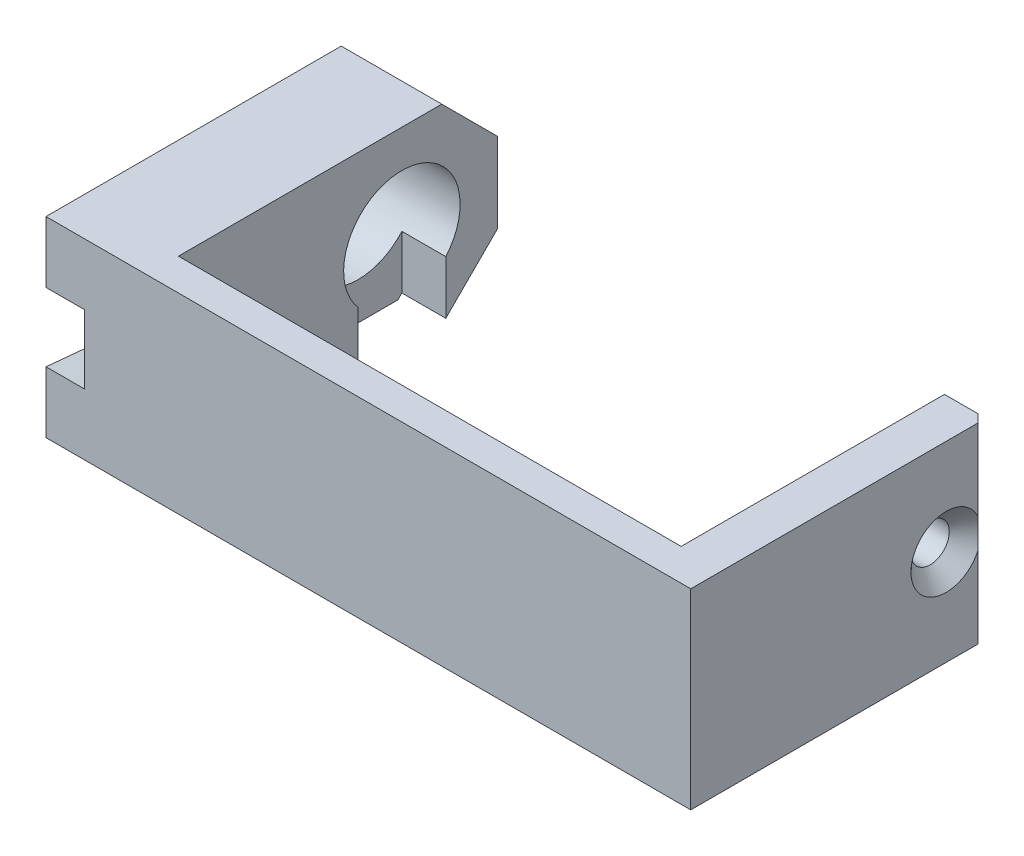
from build123d import *

# Parameters (mm, degrees)
SKETCH1_W                                       = 40.4
SKETCH1_H                                       = 12
BOSS_EXTRUDE1_DEPTH                             = 22
CUT_EXTRUDE1_REACH                              = 34.188
SKETCH2_W                                       = 31.5
SKETCH2_H                                       = 20
CUT_EXTRUDE2_REACH                              = 48.391
SKETCH4_R                                       = 0.9
CHAMFER1_SIZE                                   = 3.5
CSK_FOR_M2_FLAT_HEAD_MACHINE_SCREW1_D           = 2.4
CSK_FOR_M2_FLAT_HEAD_MACHINE_SCREW1_DEPTH       = 12.7
CSK_FOR_M2_FLAT_HEAD_MACHINE_SCREW1_CSINK_D     = 4.4
CSK_FOR_M2_FLAT_HEAD_MACHINE_SCREW1_CSINK_ANGLE = 90
CSK_FOR_M2_FLAT_HEAD_MACHINE_SCREW1_TIP         = 0.721032743
CHAMFER2_SIZE                                   = 4
BOSS_EXTRUDE2_START                             = 0.5
SKETCH20_R                                      = 2.5
SKETCH20_R_2                                    = 1.2
BOSS_EXTRUDE2_DEPTH                             = 0.5
CUT_EXTRUDE3_DEPTH                              = 2.4
SKETCH23_R                                      = 3.65
CUT_EXTRUDE4_DEPTH                              = 22.4
SKETCH24_W                                      = 5.5
SKETCH24_H                                      = 5.5
CUT_EXTRUDE5_DEPTH                              = 22.4


with BuildPart() as part:
    # Sketch1 → Boss-Extrude1 (new body)
    with BuildSketch(Plane.XY):
        Rectangle(SKETCH1_W, SKETCH1_H)
    extrude(amount=BOSS_EXTRUDE1_DEPTH)

    # Sketch2 → Cut-Extrude1 (cut, up to next)
    with BuildSketch(Plane(origin=(0, 6, 0), x_dir=(1, 0, 0), z_dir=(0, 1, 0)), mode=Mode.PRIVATE) as cut_extrude1_sk1:
        with Locations((1.85, -10)):
            Rectangle(SKETCH2_W, SKETCH2_H)
    cut_extrude1_tool1 = extrude(cut_extrude1_sk1.sketch, amount=-CUT_EXTRUDE1_REACH, mode=Mode.PRIVATE) & part.part
    add(cut_extrude1_tool1.solids().sort_by_distance((1.85, 6, 10))[0], mode=Mode.SUBTRACT)

    # Sketch4 → Cut-Extrude2 (cut, up to next)
    with BuildSketch(Plane(origin=(20.2, 0, 0), x_dir=(0, 0, -1), z_dir=(1, 0, 0)), mode=Mode.PRIVATE) as cut_extrude2_sk1:
        with Locations((-6, 0)):
            Circle(SKETCH4_R)
    cut_extrude2_tool1 = extrude(cut_extrude2_sk1.sketch, amount=-CUT_EXTRUDE2_REACH, mode=Mode.PRIVATE) & part.part
    add(cut_extrude2_tool1.solids().sort_by_distance((20.2, 0, 6))[0], mode=Mode.SUBTRACT)

    # Chamfer1
    chamfer1_edges = [part.edges().sort_by_distance(p)[0] for p in [
        (-17.05, -6, 0),
        (-17.05, 6, 0),
        (18.9, -6, 0),
        (18.9, 6, 0),
    ]]
    chamfer(chamfer1_edges, length=CHAMFER1_SIZE)

    # CSK for M2 Flat Head Machine Screw1
    with Locations(Plane(origin=(20.2, 0, 0), x_dir=(0, 0, -1), z_dir=(1, 0, 0))):
        with Locations((-6, 0)):
            CounterSinkHole(CSK_FOR_M2_FLAT_HEAD_MACHINE_SCREW1_D / 2, CSK_FOR_M2_FLAT_HEAD_MACHINE_SCREW1_CSINK_D / 2, depth=CSK_FOR_M2_FLAT_HEAD_MACHINE_SCREW1_DEPTH, counter_sink_angle=CSK_FOR_M2_FLAT_HEAD_MACHINE_SCREW1_CSINK_ANGLE)
            with Locations((0, 0, -(CSK_FOR_M2_FLAT_HEAD_MACHINE_SCREW1_DEPTH + CSK_FOR_M2_FLAT_HEAD_MACHINE_SCREW1_TIP / 2))):  # 118° drill point
                Cone(0, CSK_FOR_M2_FLAT_HEAD_MACHINE_SCREW1_D / 2, CSK_FOR_M2_FLAT_HEAD_MACHINE_SCREW1_TIP, mode=Mode.SUBTRACT)

    # Chamfer2
    # the kernel refuses this chamfer: 4 mm, written as the material it takes off along each edge
    with BuildSketch(Plane(origin=(20.2, 12.786731952, 0), x_dir=(-0.9996219169112968, 0, -0.027495876610586365), z_dir=(0, -1, 0))) as chamfer2_piece_1:
        Polygon((CHAMFER2_SIZE * 0.999621916911, -CHAMFER2_SIZE * 0.0274958766106), (-CHAMFER2_SIZE * 0.0274958766106, -CHAMFER2_SIZE * 0.999621916911), (0, 0), align=None)
    extrude(amount=25.573463904, mode=Mode.SUBTRACT)

    # Sketch20 → Boss-Extrude2 (add)
    with BuildSketch(Plane.ZY.offset(-17.6).offset(BOSS_EXTRUDE2_START)):
        with Locations(Location((6, 0, 0), (0, 0, 180))):
            Circle(SKETCH20_R)
        with Locations(Location((6, 0, 0), (0, 0, 180))):
            Circle(SKETCH20_R_2, mode=Mode.SUBTRACT)
    extrude(amount=-BOSS_EXTRUDE2_DEPTH)

    # Sketch5 → Cut-Extrude3 (cut)
    with BuildSketch(Plane.ZY.offset(20.2)):
        with BuildLine():
            Line((6.343920973, 3.633760912), (22.64787234, 2.090656963))
            ThreePointArc((22.64787234, 2.090656963), (24.55, 0), (22.64787234, -2.090656963))
            Line((22.64787234, -2.090656963), (6.343920973, -3.633760912))
            ThreePointArc((6.343920973, -3.633760912), (2.35, 0), (6.343920973, 3.633760912))
        make_face()
    extrude(amount=-CUT_EXTRUDE3_DEPTH, mode=Mode.SUBTRACT)

    # Sketch23 → Cut-Extrude4 (cut)
    with BuildSketch(Plane.ZY.offset(17.8)):
        with Locations((6, 0)):
            Circle(SKETCH23_R)
    extrude(amount=-CUT_EXTRUDE4_DEPTH, mode=Mode.SUBTRACT)

    # Sketch24 → Cut-Extrude5 (cut)
    with BuildSketch(Plane(origin=(0, 0, 0), x_dir=(-1, 0, 0), z_dir=(0, -1, 0))):
        with Locations((13.9, -6)):
            Rectangle(SKETCH24_W, SKETCH24_H)
    extrude(amount=CUT_EXTRUDE5_DEPTH, mode=Mode.SUBTRACT)


solid = part.part
